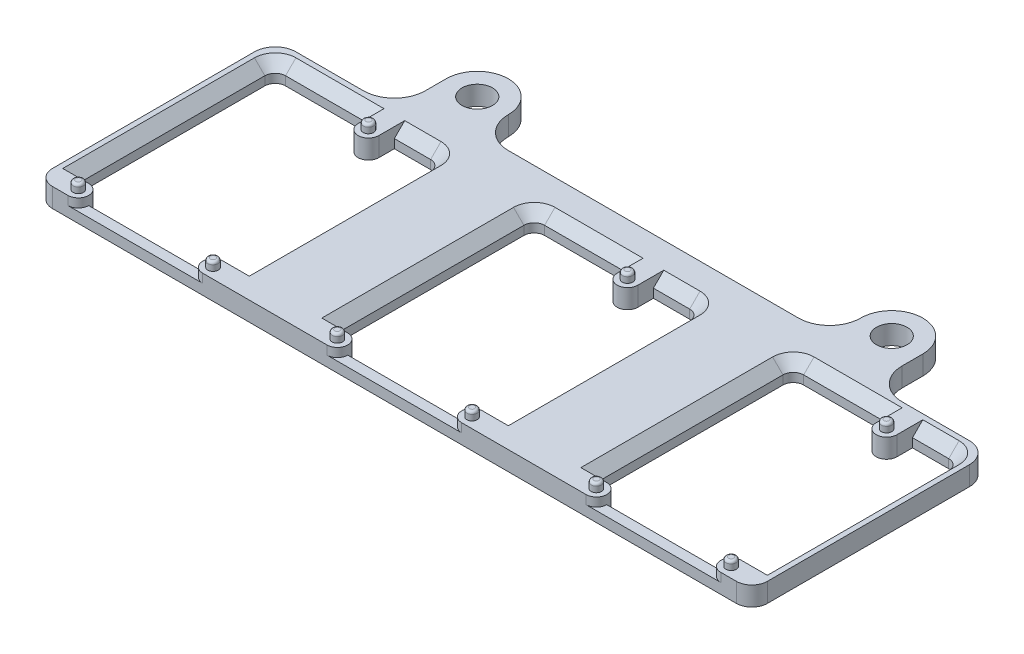
from build123d import *

# Parameters (mm, degrees)
SKETCH1_W                  = 138
SKETCH1_H                  = 46
BOSS_EXTRUDE1_DEPTH        = 3.7
SKETCH2_W                  = 34
SKETCH2_H                  = 4
BOSS_EXTRUDE2_DEPTH        = 3.7
FILLET1_R                  = 6
FILLET1_OF_MIRROR1_R       = 6
CUT_EXTRUDE1_DEPTH         = 80.345384239
FILLET2_R                  = 2
SKETCH4_R                  = 1
BOSS_EXTRUDE3_DEPTH        = 1.6
FILLET3_R                  = 0.5
SKETCH5_W                  = 26
SKETCH5_H                  = 2
BOSS_EXTRUDE4_DEPTH        = 2
LPATTERN1_COUNT            = 2
LPATTERN1_PITCH            = 50
FILLET2_OF_LPATTERN1_R     = 2
FILLET3_OF_LPATTERN1_R     = 0.5
LPATTERN1_COL_COUNT        = 2
LPATTERN1_COL_PITCH        = 50
FILLET2_OF_LPATTERN1_COL_R = 2
FILLET3_OF_LPATTERN1_COL_R = 0.5
FILLET4_R                  = 4
FILLET5_R                  = 3
CHAMFER1_SIZE              = 2


with BuildPart() as part:
    # Sketch1 → Boss-Extrude1 (new body)
    with BuildSketch(Plane(origin=(0, 0, 0), x_dir=(1, 0, 0), z_dir=(0, 1, 0))):
        Rectangle(SKETCH1_W, SKETCH1_H)
    extrude(amount=BOSS_EXTRUDE1_DEPTH)

    # Sketch2 → Boss-Extrude2 (add)
    with BuildSketch(Plane(origin=(0, 0, 0), x_dir=(1, 0, 0), z_dir=(0, 1, 0))):
        with Locations((17, 25)):
            Rectangle(SKETCH2_W, SKETCH2_H)
        with BuildLine():
            Line((34, 27), (34, 23))
            Line((34, 23), (40, 23))
            Line((40, 23), (40, 30.05))
            ThreePointArc((40, 30.05), (37.05, 33), (40, 35.95))
            Line((40, 35.95), (40, 39))
            Line((40, 39), (34, 39))
            Line((34, 39), (34, 27))
        make_face()
        with BuildLine():
            Line((40, 30.05), (40, 23))
            Line((40, 23), (46, 23))
            Line((46, 23), (46, 39))
            Line((46, 39), (40, 39))
            Line((40, 39), (40, 35.95))
            ThreePointArc((40, 35.95), (42.085965005, 35.085965005), (42.95, 33))
            ThreePointArc((42.95, 33), (42.085965005, 30.914034995), (40, 30.05))
        make_face()
    boss_extrude2 = extrude(amount=BOSS_EXTRUDE2_DEPTH)

    # Fillet1
    fillet1_edges = [part.edges().sort_by_distance(p)[0] for p in [
        (46, 1.85, -23),
        (34, 1.85, -27),
    ]]
    fillet(fillet1_edges, radius=FILLET1_R)
    fillet1_2_edges = [part.edges().sort_by_distance(p)[0] for p in [
        (34, 1.85, -39),
        (46, 1.85, -39),
    ]]
    fillet(fillet1_2_edges, radius=FILLET1_R - 0.0001)  # a hair under: the kernel refuses the full size

    # Mirror1: Boss-Extrude2 across plane
    add(boss_extrude2.mirror(Plane(origin=(0, 0, 0), x_dir=(0, 0, 1), z_dir=(1, 0, 0))))

    # Fillet1 of Mirror1
    fillet1_of_mirror1_edges = [part.edges().sort_by_distance(p)[0] for p in [
        (-46, 1.85, -23),
        (-34, 1.85, -27),
    ]]
    fillet(fillet1_of_mirror1_edges, radius=FILLET1_OF_MIRROR1_R)
    fillet1_of_mirror1_2_edges = [part.edges().sort_by_distance(p)[0] for p in [
        (-34, 1.85, -39),
        (-46, 1.85, -39),
    ]]
    fillet(fillet1_of_mirror1_2_edges, radius=FILLET1_OF_MIRROR1_R - 0.0001)  # a hair under: the kernel refuses the full size

    # Sketch3 → Cut-Extrude1 (cut, through all)
    with BuildSketch(Plane(origin=(0, 3.7, 0), x_dir=(1, 0, 0), z_dir=(0, 1, 0))):
        with BuildLine():
            Line((3, 20), (-16, 20))
            Line((-16, 20), (-16, -19))
            Line((-16, -19), (-13, -19))
            ThreePointArc((-13, -19), (-11.585786438, -19.585786438), (-11, -21))
            ThreePointArc((-11, -21), (-11.585786438, -22.414213562), (-13, -23))
            Line((-13, -23), (12.999999988, -23))
            ThreePointArc((12.999999988, -23), (11, -20.999999994), (13, -19))
            Line((13, -19), (16, -19))
            Line((16, -19), (16, 20))
            Line((16, 20), (7, 20))
            Line((7, 20), (7, 17))
            ThreePointArc((7, 17), (5, 15), (3, 17))
            Line((3, 17), (3, 20))
        make_face()
    cut_extrude1 = extrude(amount=-CUT_EXTRUDE1_DEPTH, mode=Mode.SUBTRACT)

    # Fillet2
    fillet2_edges = [part.edges().sort_by_distance(p)[0] for p in [
        (16, 1.85, -20),
        (-16, 1.85, -20),
    ]]
    fillet(fillet2_edges, radius=FILLET2_R)

    # Sketch4 → Boss-Extrude3 (add)
    with BuildSketch(Plane(origin=(0, 3.7, 0), x_dir=(1, 0, 0), z_dir=(0, 1, 0))):
        with Locations(Location((5, 17, 0), (0, 0, 270))):
            Circle(SKETCH4_R)
        with Locations(Location((13, -21, 0), (0, 0, 270))):
            Circle(SKETCH4_R)
        with Locations(Location((-13, -21, 0), (0, 0, 270))):
            Circle(SKETCH4_R)
    boss_extrude3 = extrude(amount=BOSS_EXTRUDE3_DEPTH)

    # Fillet3
    fillet3_edges = [part.edges().sort_by_distance(p)[0] for p in [
        (5, 5.3, -18),
        (13, 5.3, 20),
        (-13, 5.3, 20),
    ]]
    fillet(fillet3_edges, radius=FILLET3_R)

    # Sketch5 → Boss-Extrude4 (add)
    with BuildSketch(Plane(origin=(0, 0, 0), x_dir=(1, 0, 0), z_dir=(0, 1, 0))):
        with Locations((0, -22)):
            Rectangle(SKETCH5_W, SKETCH5_H)
    boss_extrude4 = extrude(amount=BOSS_EXTRUDE4_DEPTH)

    # LPattern1: Cut-Extrude1, Boss-Extrude3, Boss-Extrude4 ×2
    with Locations(*[(i * LPATTERN1_PITCH, 0, 0) for i in range(1, LPATTERN1_COUNT)]):
        add(cut_extrude1, mode=Mode.SUBTRACT)
        add(boss_extrude3)
        add(boss_extrude4)

    # Fillet2 of LPattern1
    fillet2_of_lpattern1_edges = [part.edges().sort_by_distance(p)[0] for p in [
        (66, 1.85, -20),
        (34, 1.85, -20),
    ]]
    fillet(fillet2_of_lpattern1_edges, radius=FILLET2_OF_LPATTERN1_R)

    # Fillet3 of LPattern1
    fillet3_of_lpattern1_edges = [part.edges().sort_by_distance(p)[0] for p in [
        (55, 5.3, -18),
        (63, 5.3, 20),
        (37, 5.3, 20),
    ]]
    fillet(fillet3_of_lpattern1_edges, radius=FILLET3_OF_LPATTERN1_R)

    # LPattern1 col: Cut-Extrude1, Boss-Extrude3, Boss-Extrude4 ×2
    with Locations(*[(-i * LPATTERN1_COL_PITCH, 0, 0) for i in range(1, LPATTERN1_COL_COUNT)]):
        add(cut_extrude1, mode=Mode.SUBTRACT)
        add(boss_extrude3)
        add(boss_extrude4)

    # Fillet2 of LPattern1 col
    fillet2_of_lpattern1_col_edges = [part.edges().sort_by_distance(p)[0] for p in [
        (-34, 1.85, -20),
        (-66, 1.85, -20),
    ]]
    fillet(fillet2_of_lpattern1_col_edges, radius=FILLET2_OF_LPATTERN1_COL_R)

    # Fillet3 of LPattern1 col
    fillet3_of_lpattern1_col_edges = [part.edges().sort_by_distance(p)[0] for p in [
        (-45, 5.3, -18),
        (-37, 5.3, 20),
        (-63, 5.3, 20),
    ]]
    fillet(fillet3_of_lpattern1_col_edges, radius=FILLET3_OF_LPATTERN1_COL_R)

    # Fillet4
    fillet4_edges = [part.edges().sort_by_distance(p)[0] for p in [
        (-69, 1.85, -23),
        (69, 1.85, -23),
    ]]
    fillet(fillet4_edges, radius=FILLET4_R)

    # Fillet5
    fillet5_edges = [part.edges().sort_by_distance(p)[0] for p in [
        (69, 1.85, 23),
        (-69, 1.85, 23),
    ]]
    fillet(fillet5_edges, radius=FILLET5_R)

    # Chamfer1
    chamfer1_edges = [part.edges().sort_by_distance(p)[0] for p in [
        (10.5, 3.7, -20),
        (16, 3.7, 0.5),
        (-16, 3.7, 0.5),
        (-5.5, 3.7, -20),
        (15.414213562, 3.7, -19.414213562),
        (-15.414213562, 3.7, -19.414213562),
        (-39.5, 3.7, -20),
        (60.5, 3.7, -20),
        (-34, 3.7, 0.5),
        (-66, 3.7, 0.5),
        (-55.5, 3.7, -20),
        (-34.585786438, 3.7, -19.414213562),
        (-65.414213562, 3.7, -19.414213562),
        (66, 3.7, 0.5),
        (34, 3.7, 0.5),
        (44.5, 3.7, -20),
        (65.414213562, 3.7, -19.414213562),
        (34.585786438, 3.7, -19.414213562),
    ]]
    chamfer(chamfer1_edges, length=CHAMFER1_SIZE)


solid = part.part
